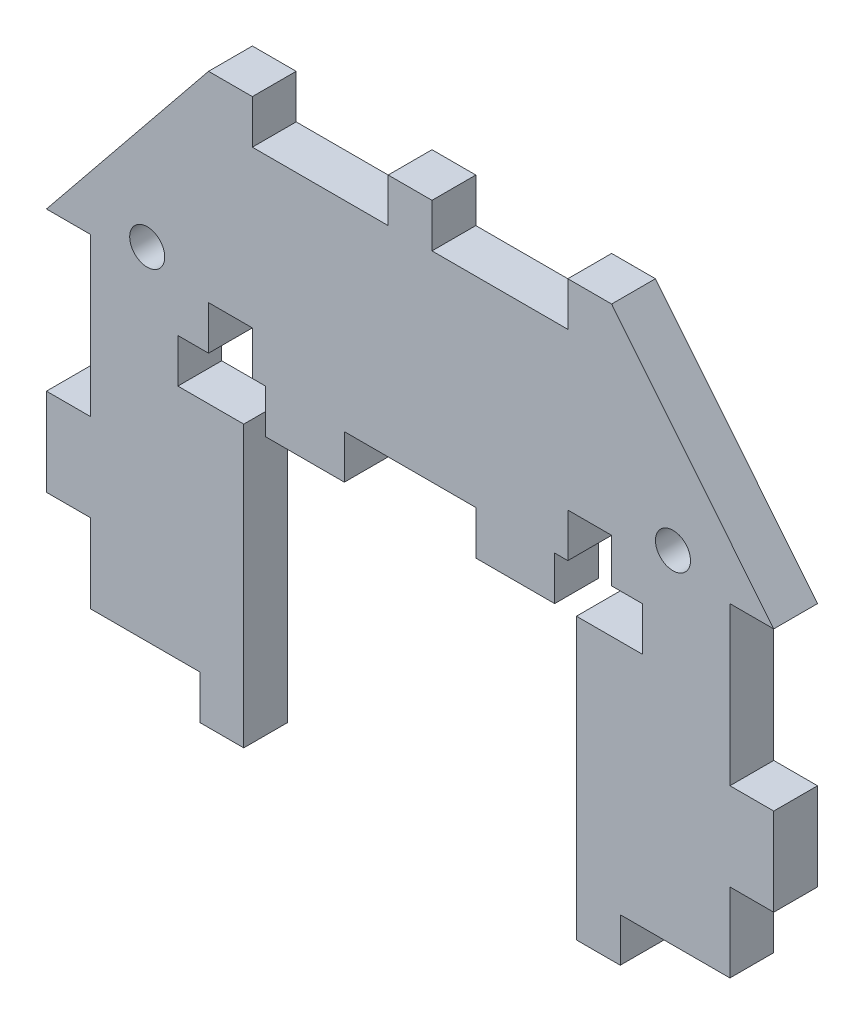
from build123d import *

# Parameters (mm, degrees)
BOSS_EXTRU_1_DEPTH         = 5
ESQUISSE2_W                = 5
ESQUISSE2_H                = 18
ESQUISSE2_W_2              = 10
ESQUISSE2_H_2              = 5
ESQUISSE2_W_3              = 15
ESQUISSE2_W_4              = 15.5
ENL_V_MAT_EXTRU_1_DEPTH    = 5
ESQUISSE3_W                = 5
ESQUISSE3_H                = 5
ENL_V_MAT_EXTRU_2_DEPTH    = 5
TROUS_DE_CENTRAGE_4_0MM1_D = 4
TROUS_DE_CENTRAGE_4_0MM2_D = 4
TROUS_DE_CENTRAGE_4_0MM3_D = 4


with BuildPart() as part:
    # Esquisse1 → Boss.-Extru.1 (new body)
    with BuildSketch(Plane.XY):
        Polygon((-23, 0), (-41.5, -22.86), (-41.5, -64.86), (-18.983337354, -64.86), (-18.983337354, -32.86), (18.983337354, -32.86), (18.983337354, -64.86), (41.5, -64.86), (41.5, -22.86), (23, 0), align=None)
    extrude(amount=BOSS_EXTRU_1_DEPTH)

    # Esquisse2 → Enlèv. mat.-Extru.1 (cut)
    with BuildSketch(Plane.XY.offset(5)):
        with Locations((39, -31.86)):
            Rectangle(ESQUISSE2_W, ESQUISSE2_H)
        Polygon((23.983337354, -64.86), (41.5, -64.86), (41.5, -50.86), (36.5, -50.86), (36.5, -59.86), (23.983337354, -59.86), align=None)
        Polygon((-41.5, -64.86), (-41.5, -50.86), (-36.5, -50.86), (-36.5, -59.86), (-23.983337354, -59.86), (-23.983337354, -64.86), align=None)
        with Locations((-39, -31.86)):
            Rectangle(ESQUISSE2_W, ESQUISSE2_H)
        with Locations((-21.5, -30.36)):
            Rectangle(ESQUISSE2_W_2, ESQUISSE2_H_2)
        with Locations((0, -30.36)):
            Rectangle(ESQUISSE2_W_3, ESQUISSE2_H_2)
        with Locations((-10.25, -2.5)):
            Rectangle(ESQUISSE2_W_4, ESQUISSE2_H_2)
        with Locations((21.5, -30.36)):
            Rectangle(ESQUISSE2_W_2, ESQUISSE2_H_2)
        with Locations((10.25, -2.5)):
            Rectangle(ESQUISSE2_W_4, ESQUISSE2_H_2)
    extrude(amount=-ENL_V_MAT_EXTRU_1_DEPTH, mode=Mode.SUBTRACT)

    # Esquisse3 → Enlèv. mat.-Extru.2 (cut)
    with BuildSketch(Plane.XY.offset(5)):
        with Locations((20.5, -25.36)):
            Rectangle(ESQUISSE3_W, ESQUISSE3_H)
        with Locations((-20.5, -25.36)):
            Rectangle(ESQUISSE3_W, ESQUISSE3_H)
    extrude(amount=-ENL_V_MAT_EXTRU_2_DEPTH, mode=Mode.SUBTRACT)

    # Trous de centrage Ø4.0mm1 (through all)
    with Locations(Plane(origin=(42.887612711, 88.220426897, -73), x_dir=(0.8606561175299535, -0.5091866527691659, 0), z_dir=(0, 0, -1))):
        with Locations((64.760887783, -88.716726196), (117.038685903, -59.271322076), (-109.849813586, -71.722814179), (-109.211382518, -11.726210894), (-7.188872317, 130.994136256), (44.450494734, 100.44293709)):
            Hole(TROUS_DE_CENTRAGE_4_0MM1_D / 2)

    # Trous de centrage Ø4.0mm2 (through all)
    with Locations(Plane(origin=(42.887612711, 88.220426897, -73), x_dir=(0.010640517801096021, 0.999943388088008, 0), z_dir=(0, 0, -1))):
        with Locations((64.760887783, -88.716726196), (117.038685903, -59.271322076), (-109.849813586, -71.722814179), (-109.211382518, -11.726210894), (-7.188872317, 130.994136256), (44.450494734, 100.44293709)):
            Hole(TROUS_DE_CENTRAGE_4_0MM2_D / 2)

    # Trous de centrage Ø4.0mm3 (through all)
    with Locations(Plane(origin=(42.887612711, 88.220426897, -73), x_dir=(-0.8712966353310426, -0.49075673531883834, -1.3383951365634842e-15), z_dir=(0, 0, -1))):
        with Locations((64.760887783, -88.716726196), (117.038685903, -59.271322076), (-109.849813586, -71.722814179), (-109.211382518, -11.726210894), (-7.188872317, 130.994136256), (44.450494734, 100.44293709)):
            Hole(TROUS_DE_CENTRAGE_4_0MM3_D / 2)


solid = part.part
